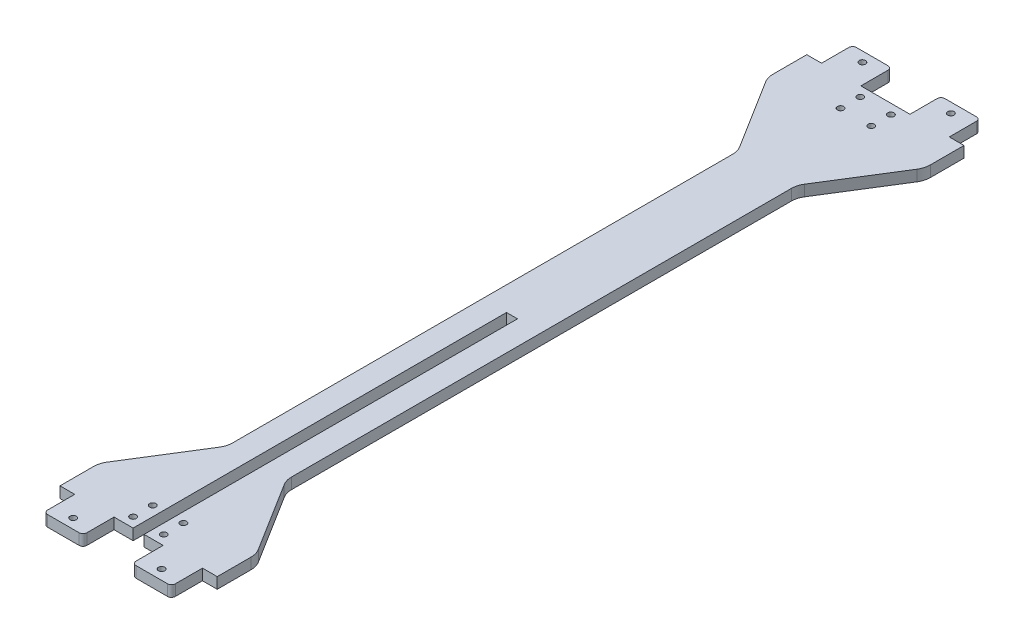
from build123d import *

# Parameters (mm, degrees)
SKETCH_1_R          = 1.6
EXTRUDE_1_DEPTH     = 5.6
CUT_EXTRUDE_1_DEPTH = 404.842791195
FILLET_1_R          = 10


with BuildPart() as part:
    # ｽｹｯﾁ1 → ﾎﾞｽ - 押し出し1 (new body)
    with BuildSketch(Plane(origin=(0, 0, 0), x_dir=(1, 0, 0), z_dir=(0, 1, 0))):
        with BuildLine():
            Line((0, 0), (7.5, 0))
            Line((7.5, 0), (7.5, -13.8))
            ThreePointArc((7.5, -13.8), (8.085786438, -15.214213562), (9.5, -15.8))
            Line((9.5, -15.8), (25.5, -15.8))
            ThreePointArc((25.5, -15.8), (26.914213562, -15.214213562), (27.5, -13.8))
            Line((27.5, -13.8), (27.5, 0))
            Line((27.5, 0), (37.2, 0))
            Line((37.2, 0), (37.2, 190))
            Line((37.2, 190), (42.8, 190))
            Line((42.8, 190), (42.8, 0))
            Line((42.8, 0), (52.5, 0))
            Line((52.5, 0), (52.5, -13.8))
            ThreePointArc((52.5, -13.8), (53.085786438, -15.214213562), (54.5, -15.8))
            Line((54.5, -15.8), (70.5, -15.8))
            ThreePointArc((70.5, -15.8), (71.914213562, -15.214213562), (72.5, -13.8))
            Line((72.5, -13.8), (72.5, 0))
            Line((72.5, 0), (80, 0))
            Line((80, 0), (80, 380))
            Line((80, 380), (72.5, 380))
            Line((72.5, 380), (72.5, 393.8))
            ThreePointArc((72.5, 393.8), (71.914213562, 395.214213562), (70.5, 395.8))
            Line((70.5, 395.8), (54.5, 395.8))
            ThreePointArc((54.5, 395.8), (53.085786438, 395.214213562), (52.5, 393.8))
            Line((52.5, 393.8), (52.5, 380))
            Line((52.5, 380), (27.5, 380))
            Line((27.5, 380), (27.5, 393.8))
            ThreePointArc((27.5, 393.8), (26.914213562, 395.214213562), (25.5, 395.8))
            Line((25.5, 395.8), (9.5, 395.8))
            ThreePointArc((9.5, 395.8), (8.085786438, 395.214213562), (7.5, 393.8))
            Line((7.5, 393.8), (7.5, 380))
            Line((7.5, 380), (0, 380))
            Line((0, 380), (0, 0))
        make_face()
        with Locations((62.5, -10.8)):
            Circle(SKETCH_1_R, mode=Mode.SUBTRACT)
        with Locations((17.5, -10.8)):
            Circle(SKETCH_1_R, mode=Mode.SUBTRACT)
        with Locations((17.5, 390.8)):
            Circle(SKETCH_1_R, mode=Mode.SUBTRACT)
        with Locations((62.5, 390.8)):
            Circle(SKETCH_1_R, mode=Mode.SUBTRACT)
        with Locations((47.8, 375)):
            Circle(SKETCH_1_R, mode=Mode.SUBTRACT)
        with Locations((32.2, 375)):
            Circle(SKETCH_1_R, mode=Mode.SUBTRACT)
        with Locations((47.8, 5)):
            Circle(SKETCH_1_R, mode=Mode.SUBTRACT)
        with Locations((32.2, 5)):
            Circle(SKETCH_1_R, mode=Mode.SUBTRACT)
        with Locations((47.8, 365)):
            Circle(SKETCH_1_R, mode=Mode.SUBTRACT)
        with Locations((32.2, 365)):
            Circle(SKETCH_1_R, mode=Mode.SUBTRACT)
        with Locations((47.8, 15)):
            Circle(SKETCH_1_R, mode=Mode.SUBTRACT)
        with Locations((32.2, 15)):
            Circle(SKETCH_1_R, mode=Mode.SUBTRACT)
    extrude(amount=EXTRUDE_1_DEPTH)

    # ｽｹｯﾁ2 → ｶｯﾄ - 押し出し1 (cut, through all)
    with BuildSketch(Plane(origin=(0, 5.6, 0), x_dir=(1, 0, 0), z_dir=(0, 1, 0))):
        Polygon((80, 60), (80, 320), (80, 360), (55, 320), (55, 60), (80, 20), align=None)
        Polygon((25, 60), (25, 320), (0, 360), (0, 320), (0, 60), (0, 20), align=None)
    extrude(amount=-CUT_EXTRUDE_1_DEPTH, mode=Mode.SUBTRACT)

    # ﾌｨﾚｯﾄ1
    fillet_1_edges = [part.edges().sort_by_distance(p)[0] for p in [
        (80, 2.8, -360),
        (55, 2.8, -320),
        (0, 2.8, -360),
        (25, 2.8, -320),
        (25, 2.8, -60),
        (0, 2.8, -20),
        (80, 2.8, -20),
        (55, 2.8, -60),
    ]]
    fillet(fillet_1_edges, radius=FILLET_1_R)


solid = part.part
